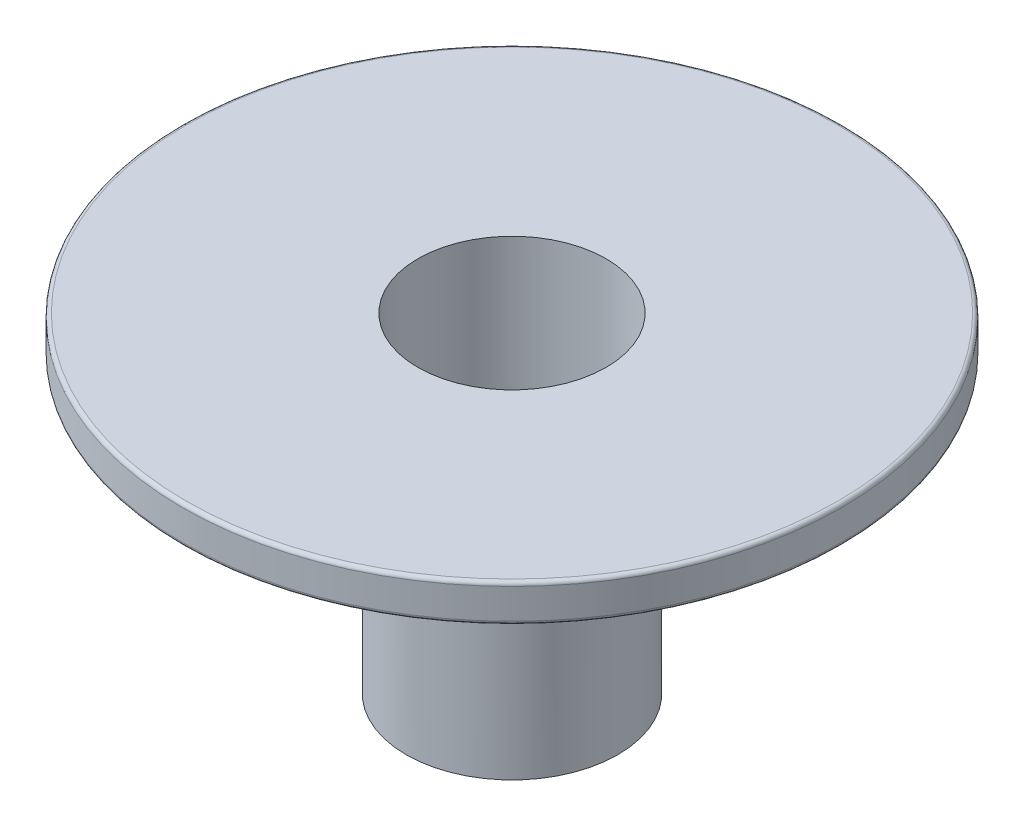
from build123d import *

# Parameters (mm, degrees)
SKETCH_1_R          = 22.5
SKETCH_1_R_2        = 20
EXTRUDE_1_DEPTH     = 70
FILLET_1_R          = 0.8
FILLET_2_R          = 0.8
SKETCH_5_R          = 20
SKETCH_5_R_2        = 11
EXTRUDE_3_DEPTH     = 11.7
SKETCH_6_R          = 3.2
CUT_EXTRUDE_1_DEPTH = 7.5


with BuildPart() as part:
    # Эскиз1 → Бобышка-Вытянуть1 (new body)
    with BuildSketch(Plane(origin=(0, 0, 0), x_dir=(1, 0, 0), z_dir=(0, 1, 0))):
        Circle(SKETCH_1_R)
        Circle(SKETCH_1_R_2, mode=Mode.SUBTRACT)
    extrude(amount=EXTRUDE_1_DEPTH)

    # Эскиз3 → Повернуть3 (revolve)
    with BuildSketch(Plane.XY):
        Polygon((22.5, 40), (27.5, 40), (27.5, 58), (45, 58), (45, 67), (65, 67), (65, 62), (70, 62), (70, 70), (22.5, 70), align=None)
    revolve(axis=Axis((0, 0, 0), (0, 1, 0)))

    # Скругление1
    fillet_1_edges = [part.edges().sort_by_distance(p)[0] for p in [
        (-70, 70, 0),
        (-70, 62, 0),
        (-65, 62, 0),
        (-65, 67, 0),
    ]]
    fillet(fillet_1_edges, radius=FILLET_1_R)

    # Скругление2
    fillet_2_edges = [part.edges().sort_by_distance(p)[0] for p in [
        (-22.5, 40, 0),
        (-27.5, 40, 0),
        (-27.5, 58, 0),
        (-45, 58, 0),
        (-45, 67, 0),
    ]]
    fillet(fillet_2_edges, radius=FILLET_2_R)

    # Эскиз5 → Бобышка-Вытянуть3 (add)
    with BuildSketch(Plane.XZ):
        Circle(SKETCH_5_R)
        Circle(SKETCH_5_R_2, mode=Mode.SUBTRACT)
    extrude(amount=-EXTRUDE_3_DEPTH)

    # Эскиз6 → Вырез-Вытянуть1 (cut)
    with BuildSketch(Plane(origin=(0, 11.7, 0), x_dir=(1, 0, 0), z_dir=(0, 1, 0))):
        with Locations((0, 15.5)):
            Circle(SKETCH_6_R)
        with Locations((13.423393759, -7.75)):
            Circle(SKETCH_6_R)
        with Locations((-13.423393759, -7.75)):
            Circle(SKETCH_6_R)
    extrude(amount=-CUT_EXTRUDE_1_DEPTH, mode=Mode.SUBTRACT)


solid = part.part
